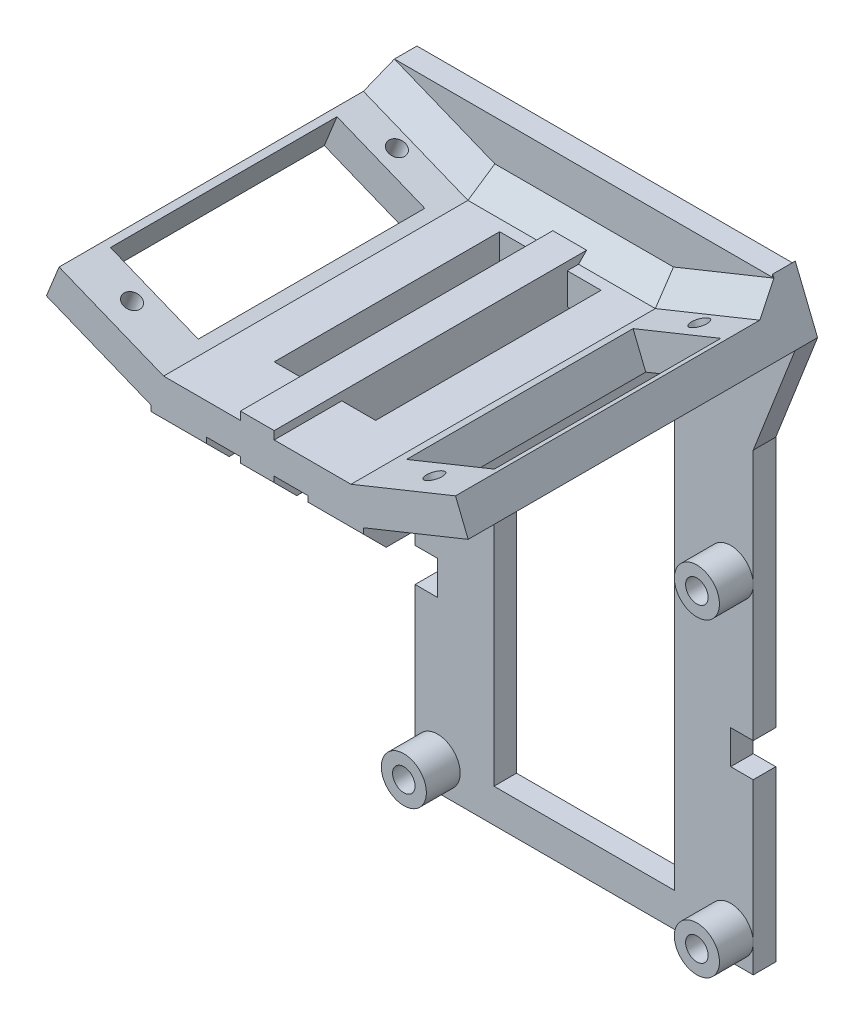
from build123d import *

# Parameters (mm, degrees)
EXTRUDE_1_DEPTH      = 2
EXTRUDE_2_DEPTH      = 29
EXTRUDE_2_DEPTH_BACK = 2
CUT_EXTRUDE_5_REACH  = 60.965
SKETCH_3_R           = 0.75
SKETCH_3_W           = 9
SKETCH_3_H           = 20.1
CUT_EXTRUDE_7_REACH  = 61.851
SKETCH_12_R          = 0.75
SKETCH_12_W          = 9
SKETCH_12_H          = 20.1
CUT_EXTRUDE_8_REACH  = 71.217
SKETCH_13_R          = 1
SKETCH_13_W          = 16
SKETCH_13_H          = 38.074491789
SKETCH_13_W_2        = 2
SKETCH_13_H_2        = 3
CHAMFER_4_SIZE       = 1
CHAMFER_5_SIZE       = 2
EXTRUDE_START        = -29
SKETCH_14_W          = 3
SKETCH_14_H          = 6
SKETCH_14_W_2        = 4.936896873
SKETCH_14_H_2        = 2.5
EXTRUDE_8_DEPTH      = 29
CHAMFER_6_SIZE       = 2
EXTRUDE_START_2      = 3
SKETCH_15_R          = 2
SKETCH_15_R_2        = 1
EXTRUDE_9_DEPTH      = 3
CUT_EXTRUDE_9_REACH  = 60.599
SKETCH_16_W          = 3
SKETCH_16_H          = 20
EXTRUDE_10_DEPTH     = 2
EXTRUDE_11_DEPTH     = 24.1
CUT_EXTRUDE_11_REACH = 71.217
SKETCH_20_W          = 33.566306147
SKETCH_20_H          = 6.687524296


with BuildPart() as part:
    # 草圖1 → 填料-伸長1 (new body)
    with BuildSketch(Plane.XY):
        Polygon((-15, 0), (15, 0), (15, -1), (18.708735418, -10.179442277), (15, -11.67786865), (15, -60), (-15, -60), (-15, -11.67786865), (-18.708735418, -10.179442277), (-15, -1), align=None)
    extrude(amount=EXTRUDE_1_DEPTH)

    # 草圖2 → 填料-伸長2 (add, two sides: drawn at the far end of the back side and taken through both)
    with BuildSketch(Plane.XY.offset(2).offset(-EXTRUDE_2_DEPTH_BACK)):
        Polygon((-18.708735418, -10.179442277), (-9.436896873, -13.925508211), (9.436896873, -13.925508211), (18.708735418, -10.179442277), (17.584915638, -7.397890713), (8.313077092, -11.143956647), (-8.313077092, -11.143956647), (-17.584915638, -7.397890713), align=None)
    extrude(amount=EXTRUDE_2_DEPTH + EXTRUDE_2_DEPTH_BACK)

    # 草圖3 → 除料-伸長5 (cut, up to next)
    with BuildSketch(Plane(origin=(4.914686172, -15.752599933, 0), x_dir=(0.9271838545667884, 0.37460659341590963, 0), z_dir=(-0.37460659341590963, 0.9271838545667884, 0)), mode=Mode.PRIVATE) as cut_extrude_5_sk1:
        with Locations(Location((10.377361354, -5.2, 0), (0, 0, 180))):
            Circle(SKETCH_3_R)
    cut_extrude_5_tool1 = extrude(cut_extrude_5_sk1.sketch, amount=CUT_EXTRUDE_5_REACH, mode=Mode.PRIVATE) & part.part
    # 草圖3 → 除料-伸長5 (cut, up to next)
    with BuildSketch(Plane(origin=(4.914686172, -15.752599933, 0), x_dir=(0.9271838545667884, 0.37460659341590963, 0), z_dir=(-0.37460659341590963, 0.9271838545667884, 0)), mode=Mode.PRIVATE) as cut_extrude_5_sk2:
        with Locations(Location((10.377361354, -28.7, 0), (0, 0, 180))):
            Circle(SKETCH_3_R)
    cut_extrude_5_tool2 = extrude(cut_extrude_5_sk2.sketch, amount=CUT_EXTRUDE_5_REACH, mode=Mode.PRIVATE) & part.part
    # 草圖3 → 除料-伸長5 (cut, up to next)
    with BuildSketch(Plane(origin=(4.914686172, -15.752599933, 0), x_dir=(0.9271838545667884, 0.37460659341590963, 0), z_dir=(-0.37460659341590963, 0.9271838545667884, 0)), mode=Mode.PRIVATE) as cut_extrude_5_sk3:
        with Locations((10.377361354, -16.95)):
            Rectangle(SKETCH_3_W, SKETCH_3_H)
    cut_extrude_5_tool3 = extrude(cut_extrude_5_sk3.sketch, amount=CUT_EXTRUDE_5_REACH, mode=Mode.PRIVATE) & part.part
    add(cut_extrude_5_tool1.solids().sort_by_distance((14.536408, -11.865172, 5.2))[0], mode=Mode.SUBTRACT)
    add(cut_extrude_5_tool2.solids().sort_by_distance((14.536408, -11.865172, 28.7))[0], mode=Mode.SUBTRACT)
    add(cut_extrude_5_tool3.solids().sort_by_distance((14.536408, -11.865172, 16.95))[0], mode=Mode.SUBTRACT)

    # 草圖12 → 除料-伸長7 (cut, up to next)
    with BuildSketch(Plane(origin=(-6.161016101, -15.249049955, 0), x_dir=(0.9271838545667846, -0.3746065934159192, 0), z_dir=(-0.3746065934159192, -0.9271838545667846, 0)), mode=Mode.PRIVATE) as cut_extrude_7_sk1:
        with Locations((-9.033151225, 28.7)):
            Circle(SKETCH_12_R)
    cut_extrude_7_tool1 = extrude(cut_extrude_7_sk1.sketch, amount=-CUT_EXTRUDE_7_REACH, mode=Mode.PRIVATE) & part.part
    # 草圖12 → 除料-伸長7 (cut, up to next)
    with BuildSketch(Plane(origin=(-6.161016101, -15.249049955, 0), x_dir=(0.9271838545667846, -0.3746065934159192, 0), z_dir=(-0.3746065934159192, -0.9271838545667846, 0)), mode=Mode.PRIVATE) as cut_extrude_7_sk2:
        with Locations((-9.033151225, 5.2)):
            Circle(SKETCH_12_R)
    cut_extrude_7_tool2 = extrude(cut_extrude_7_sk2.sketch, amount=-CUT_EXTRUDE_7_REACH, mode=Mode.PRIVATE) & part.part
    # 草圖12 → 除料-伸長7 (cut, up to next)
    with BuildSketch(Plane(origin=(-6.161016101, -15.249049955, 0), x_dir=(0.9271838545667846, -0.3746065934159192, 0), z_dir=(-0.3746065934159192, -0.9271838545667846, 0)), mode=Mode.PRIVATE) as cut_extrude_7_sk3:
        with Locations((-9.033151225, 16.95)):
            Rectangle(SKETCH_12_W, SKETCH_12_H)
    cut_extrude_7_tool3 = extrude(cut_extrude_7_sk3.sketch, amount=-CUT_EXTRUDE_7_REACH, mode=Mode.PRIVATE) & part.part
    add(cut_extrude_7_tool1.solids().sort_by_distance((-14.536408, -11.865172, 28.7))[0], mode=Mode.SUBTRACT)
    add(cut_extrude_7_tool2.solids().sort_by_distance((-14.536408, -11.865172, 5.2))[0], mode=Mode.SUBTRACT)
    add(cut_extrude_7_tool3.solids().sort_by_distance((-14.536408, -11.865172, 16.95))[0], mode=Mode.SUBTRACT)

    # 草圖13 → 除料-伸長8 (cut, up to next)
    with BuildSketch(Plane.XY.offset(2), mode=Mode.PRIVATE) as cut_extrude_8_sk1:
        with Locations((-13, -30)):
            Circle(SKETCH_13_R)
    cut_extrude_8_tool1 = extrude(cut_extrude_8_sk1.sketch, amount=-CUT_EXTRUDE_8_REACH, mode=Mode.PRIVATE) & part.part
    # 草圖13 → 除料-伸長8 (cut, up to next)
    with BuildSketch(Plane.XY.offset(2), mode=Mode.PRIVATE) as cut_extrude_8_sk2:
        with Locations((13, -30)):
            Circle(SKETCH_13_R)
    cut_extrude_8_tool2 = extrude(cut_extrude_8_sk2.sketch, amount=-CUT_EXTRUDE_8_REACH, mode=Mode.PRIVATE) & part.part
    # 草圖13 → 除料-伸長8 (cut, up to next)
    with BuildSketch(Plane.XY.offset(2), mode=Mode.PRIVATE) as cut_extrude_8_sk3:
        with Locations((-13, -57.5)):
            Circle(SKETCH_13_R)
    cut_extrude_8_tool3 = extrude(cut_extrude_8_sk3.sketch, amount=-CUT_EXTRUDE_8_REACH, mode=Mode.PRIVATE) & part.part
    # 草圖13 → 除料-伸長8 (cut, up to next)
    with BuildSketch(Plane.XY.offset(2), mode=Mode.PRIVATE) as cut_extrude_8_sk4:
        with Locations((13, -57.5)):
            Circle(SKETCH_13_R)
    cut_extrude_8_tool4 = extrude(cut_extrude_8_sk4.sketch, amount=-CUT_EXTRUDE_8_REACH, mode=Mode.PRIVATE) & part.part
    # 草圖13 → 除料-伸長8 (cut, up to next)
    with BuildSketch(Plane.XY.offset(2), mode=Mode.PRIVATE) as cut_extrude_8_sk5:
        with Locations((0, -37.962754105)):
            Rectangle(SKETCH_13_W, SKETCH_13_H)
    cut_extrude_8_tool5 = extrude(cut_extrude_8_sk5.sketch, amount=-CUT_EXTRUDE_8_REACH, mode=Mode.PRIVATE) & part.part
    # 草圖13 → 除料-伸長8 (cut, up to next)
    with BuildSketch(Plane.XY.offset(2), mode=Mode.PRIVATE) as cut_extrude_8_sk6:
        with Locations((-14, -43.5)):
            Rectangle(SKETCH_13_W_2, SKETCH_13_H_2)
    cut_extrude_8_tool6 = extrude(cut_extrude_8_sk6.sketch, amount=-CUT_EXTRUDE_8_REACH, mode=Mode.PRIVATE) & part.part
    # 草圖13 → 除料-伸長8 (cut, up to next)
    with BuildSketch(Plane.XY.offset(2), mode=Mode.PRIVATE) as cut_extrude_8_sk7:
        with Locations((14, -43.5)):
            Rectangle(SKETCH_13_W_2, SKETCH_13_H_2)
    cut_extrude_8_tool7 = extrude(cut_extrude_8_sk7.sketch, amount=-CUT_EXTRUDE_8_REACH, mode=Mode.PRIVATE) & part.part
    add(cut_extrude_8_tool1.solids().sort_by_distance((-13, -30, 2))[0], mode=Mode.SUBTRACT)
    add(cut_extrude_8_tool2.solids().sort_by_distance((13, -30, 2))[0], mode=Mode.SUBTRACT)
    add(cut_extrude_8_tool3.solids().sort_by_distance((-13, -57.5, 2))[0], mode=Mode.SUBTRACT)
    add(cut_extrude_8_tool4.solids().sort_by_distance((13, -57.5, 2))[0], mode=Mode.SUBTRACT)
    add(cut_extrude_8_tool5.solids().sort_by_distance((0, -37.962754, 2))[0], mode=Mode.SUBTRACT)
    add(cut_extrude_8_tool6.solids().sort_by_distance((-14, -43.5, 2))[0], mode=Mode.SUBTRACT)
    add(cut_extrude_8_tool7.solids().sort_by_distance((14, -43.5, 2))[0], mode=Mode.SUBTRACT)

    # 導角4
    chamfer_4_edges = [part.edges().sort_by_distance(p)[0] for p in [
        (-15, 0, 1),
        (15, 0, 1),
    ]]
    chamfer(chamfer_4_edges, length=CHAMFER_4_SIZE - 0.0001)  # a hair under: the kernel refuses the full size

    # 導角5
    chamfer_5_edges = [part.edges().sort_by_distance(p)[0] for p in [
        (-12.948996365, -9.27092368, 2),
        (0, -11.143956647, 2),
        (12.948996365, -9.27092368, 2),
    ]]
    chamfer(chamfer_5_edges, length=CHAMFER_5_SIZE)

    # 草圖14 → 填料-伸長8 (add)
    with BuildSketch(Plane.XY.offset(31).offset(EXTRUDE_START)):
        with Locations((0, -13.425508211)):
            Rectangle(SKETCH_14_W, SKETCH_14_H)
        with Locations((-6.968448437, -15.175508211)):
            Rectangle(SKETCH_14_W_2, SKETCH_14_H_2)
        with Locations((6.968448437, -15.175508211)):
            Rectangle(SKETCH_14_W_2, SKETCH_14_H_2)
    extrude(amount=EXTRUDE_8_DEPTH)

    # 導角6
    chamfer_6_edges = [part.edges().sort_by_distance(p)[0] for p in [
        (0, -16.425508211, 31),
        (-6.968448436, -16.425508211, 31),
        (6.968448436, -16.425508211, 31),
    ]]
    chamfer(chamfer_6_edges, length=CHAMFER_6_SIZE)

    # 草圖15 → 填料-伸長9 (add)
    # profile 1 of 4: a face of its own
    with BuildSketch(Plane.XY.offset(2).offset(EXTRUDE_START_2)):
        with Locations(Location((-13, -30, 0), (0, 0, 180))):
            Circle(SKETCH_15_R)
        with Locations((-13, -30)):
            Circle(SKETCH_15_R_2, mode=Mode.SUBTRACT)
    # profile 2 of 4: a face of its own
    with BuildSketch(Plane.XY.offset(2).offset(EXTRUDE_START_2)):
        with Locations((13, -30)):
            Circle(SKETCH_15_R)
        with Locations((13, -30)):
            Circle(SKETCH_15_R_2, mode=Mode.SUBTRACT)
    # profile 3 of 4: a face of its own
    with BuildSketch(Plane.XY.offset(2).offset(EXTRUDE_START_2)):
        with Locations((13, -57.5)):
            Circle(SKETCH_15_R)
        with Locations((13, -57.5)):
            Circle(SKETCH_15_R_2, mode=Mode.SUBTRACT)
    # profile 4 of 4: a face of its own
    with BuildSketch(Plane.XY.offset(2).offset(EXTRUDE_START_2)):
        with Locations(Location((-13, -57.5, 0), (0, 0, 180))):
            Circle(SKETCH_15_R)
        with Locations((-13, -57.5)):
            Circle(SKETCH_15_R_2, mode=Mode.SUBTRACT)
    extrude(amount=-EXTRUDE_9_DEPTH)

    # 草圖16 → 除料-伸長9 (cut, up to next)
    with BuildSketch(Plane.XZ.offset(13.925508211), mode=Mode.PRIVATE) as cut_extrude_9_sk1:
        with Locations((-3, 15)):
            Rectangle(SKETCH_16_W, SKETCH_16_H)
    cut_extrude_9_tool1 = extrude(cut_extrude_9_sk1.sketch, amount=-CUT_EXTRUDE_9_REACH, mode=Mode.PRIVATE) & part.part
    # 草圖16 → 除料-伸長9 (cut, up to next)
    with BuildSketch(Plane.XZ.offset(13.925508211), mode=Mode.PRIVATE) as cut_extrude_9_sk2:
        with Locations((3, 15)):
            Rectangle(SKETCH_16_W, SKETCH_16_H)
    cut_extrude_9_tool2 = extrude(cut_extrude_9_sk2.sketch, amount=-CUT_EXTRUDE_9_REACH, mode=Mode.PRIVATE) & part.part
    add(cut_extrude_9_tool1.solids().sort_by_distance((-3, -13.925508, 15))[0], mode=Mode.SUBTRACT)
    add(cut_extrude_9_tool2.solids().sort_by_distance((3, -13.925508, 15))[0], mode=Mode.SUBTRACT)

    # 草圖17 → 填料-伸長10 (add)
    with BuildSketch(Plane(origin=(0, 0, 0), x_dir=(-1, 0, 0), z_dir=(0, 0, -1))):
        Polygon((-18.708735418, -10.179442277), (-15, -19.67786865), (-15, -11.67786865), align=None)
        Polygon((18.708735418, -10.179442277), (15, -11.67786865), (15, -19.67786865), align=None)
    extrude(amount=-EXTRUDE_10_DEPTH)

    # 草圖18 → 填料-伸長11 (add)
    with BuildSketch(Plane.XY.offset(31)):
        Polygon((-17.584915638, -7.397890713), (-18.708735418, -10.179442277), (-18.152425106, -10.404206233), (-17.028605325, -7.622654669), align=None)
        Polygon((17.584915638, -7.397890713), (18.708735418, -10.179442277), (18.152425106, -10.404206233), (17.028605325, -7.622654669), align=None)
    extrude(amount=-EXTRUDE_11_DEPTH)

    # 草圖20 → 除料-伸長11 (cut, up to next)
    with BuildSketch(Plane.XY.offset(2), mode=Mode.PRIVATE) as cut_extrude_11_sk1:
        with Locations((-0.052549378, -2.199760856)):
            Rectangle(SKETCH_20_W, SKETCH_20_H)
    cut_extrude_11_tool1 = extrude(cut_extrude_11_sk1.sketch, amount=-CUT_EXTRUDE_11_REACH, mode=Mode.PRIVATE) & part.part
    add(cut_extrude_11_tool1.solids().sort_by_distance((-0.052549, -2.199761, 2))[0], mode=Mode.SUBTRACT)


solid = part.part
